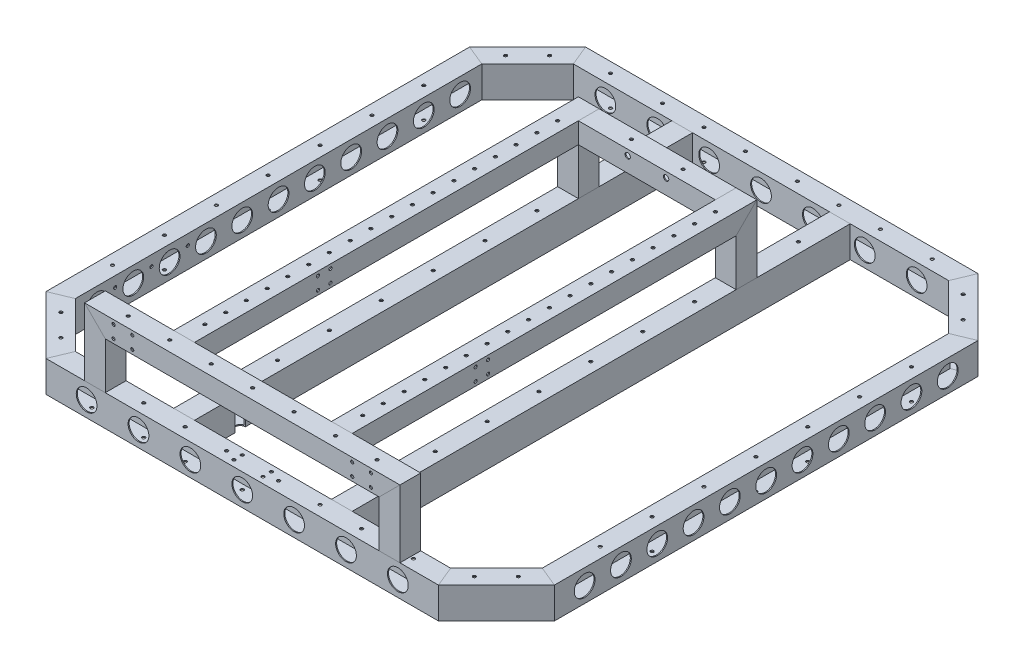
from build123d import *

# Parameters (mm, degrees)
WL_30X20X1_1_DEPTH          = 408.467341191
WL_30X20X1_1_DEPTH_BACK     = 8.467341191
SKETCH_11_W                 = 20
SKETCH_11_H                 = 30
SKETCH_11_W_2               = 18
SKETCH_11_H_2               = 28
SKETCH_11_ON_SEGMENT_2_W    = 20
SKETCH_11_ON_SEGMENT_2_H    = 30
SKETCH_11_ON_SEGMENT_2_W_2  = 18
SKETCH_11_ON_SEGMENT_2_H_2  = 28
WL_30X20X1_1_2_DEPTH        = 87.6453605
SKETCH_11_ON_SEGMENT_3_W    = 20
SKETCH_11_ON_SEGMENT_3_H    = 30
SKETCH_11_ON_SEGMENT_3_W_2  = 18
SKETCH_11_ON_SEGMENT_3_H_2  = 28
WL_30X20X1_1_3_DEPTH        = 386.934682381
SKETCH_11_ON_SEGMENT_4_W    = 20
SKETCH_11_ON_SEGMENT_4_H    = 30
SKETCH_11_ON_SEGMENT_4_W_2  = 18
SKETCH_11_ON_SEGMENT_4_H_2  = 28
WL_30X20X1_1_4_DEPTH        = 87.6453605
SKETCH_11_ON_SEGMENT_5_W    = 20
SKETCH_11_ON_SEGMENT_5_H    = 30
SKETCH_11_ON_SEGMENT_5_W_2  = 18
SKETCH_11_ON_SEGMENT_5_H_2  = 28
WL_30X20X1_1_5_DEPTH        = 416.934682381
SKETCH_11_ON_SEGMENT_6_W    = 20
SKETCH_11_ON_SEGMENT_6_H    = 30
SKETCH_11_ON_SEGMENT_6_W_2  = 18
SKETCH_11_ON_SEGMENT_6_H_2  = 28
WL_30X20X1_1_6_DEPTH        = 87.6453605
SKETCH_11_ON_SEGMENT_7_W    = 20
SKETCH_11_ON_SEGMENT_7_H    = 30
SKETCH_11_ON_SEGMENT_7_W_2  = 18
SKETCH_11_ON_SEGMENT_7_H_2  = 28
WL_30X20X1_1_7_DEPTH        = 386.934682381
SKETCH_11_ON_SEGMENT_8_W    = 20
SKETCH_11_ON_SEGMENT_8_H    = 30
SKETCH_11_ON_SEGMENT_8_W_2  = 18
SKETCH_11_ON_SEGMENT_8_H_2  = 28
WL_30X20X1_1_8_DEPTH        = 87.6453605
SKETCH_11_ON_SEGMENT_9_W    = 20
SKETCH_11_ON_SEGMENT_9_H    = 30
SKETCH_11_ON_SEGMENT_9_W_2  = 18
SKETCH_11_ON_SEGMENT_9_H_2  = 28
WL_30X20X1_1_9_DEPTH        = 502
SKETCH_11_ON_SEGMENT_10_W   = 20
SKETCH_11_ON_SEGMENT_10_H   = 30
SKETCH_11_ON_SEGMENT_10_W_2 = 18
SKETCH_11_ON_SEGMENT_10_H_2 = 28
WL_30X20X1_1_10_DEPTH       = 502
SKETCH_16_W                 = 20
SKETCH_16_H                 = 20
SKETCH_16_W_2               = 18
SKETCH_16_H_2               = 18
WL_20X20X1_1_DEPTH          = 70.142135624
SKETCH_16_ON_SEGMENT_2_W    = 20
SKETCH_16_ON_SEGMENT_2_H    = 20
SKETCH_16_ON_SEGMENT_2_W_2  = 18
SKETCH_16_ON_SEGMENT_2_H_2  = 18
WL_20X20X1_1_2_DEPTH        = 314.284271247
SKETCH_16_ON_SEGMENT_3_W    = 20
SKETCH_16_ON_SEGMENT_3_H    = 20
SKETCH_16_ON_SEGMENT_3_W_2  = 18
SKETCH_16_ON_SEGMENT_3_H_2  = 18
WL_20X20X1_1_3_DEPTH        = 70.142135624
SKETCH_17_ON_SEGMENT_1_W    = 20
SKETCH_17_ON_SEGMENT_1_H    = 20
SKETCH_17_ON_SEGMENT_1_W_2  = 18
SKETCH_17_ON_SEGMENT_1_H_2  = 18
WL_20X20X1_2_DEPTH          = 70.142135624
WL_20X20X1_2_2_DEPTH        = 380
WL_20X20X1_2_2_DEPTH_BACK   = 15.142135624
SKETCH_17_W                 = 20
SKETCH_17_H                 = 20
SKETCH_17_W_2               = 18
SKETCH_17_H_2               = 18
SKETCH_17_ON_SEGMENT_3_W    = 20
SKETCH_17_ON_SEGMENT_3_H    = 20
SKETCH_17_ON_SEGMENT_3_W_2  = 18
SKETCH_17_ON_SEGMENT_3_H_2  = 18
WL_20X20X1_2_3_DEPTH        = 70.142135624
SKETCH_17_ON_SEGMENT_4_W    = 20
SKETCH_17_ON_SEGMENT_4_H    = 20
SKETCH_17_ON_SEGMENT_4_W_2  = 18
SKETCH_17_ON_SEGMENT_4_H_2  = 18
WL_20X20X1_2_4_DEPTH        = 395.142135624
SKETCH_19_W                 = 20
SKETCH_19_H                 = 20
SKETCH_19_W_2               = 18
SKETCH_19_H_2               = 18
WL_20X20X1_3_DEPTH          = 132
SKETCH_20_R                 = 5
CUT_EXTRUDE_1_DEPTH         = 30
SKETCH_21_R                 = 1.5
CUT_EXTRUDE_2_DEPTH         = 30
SKETCH_22_R                 = 1.5
CUT_EXTRUDE_3_DEPTH         = 30
SKETCH_23_R                 = 1.5
CUT_EXTRUDE_4_DEPTH         = 20
SKETCH_24_R                 = 1.5
CUT_EXTRUDE_5_DEPTH         = 30
SKETCH_25_R                 = 1.5
CUT_EXTRUDE_6_DEPTH         = 20
SKETCH_26_R                 = 1.5
CUT_EXTRUDE_7_DEPTH         = 20
SKETCH_27_R                 = 2.6
CUT_EXTRUDE_8_DEPTH         = 20
SKETCH_28_R                 = 1.5
CUT_EXTRUDE_9_DEPTH         = 425.622875107
SKETCH_30_R                 = 10
CUT_EXTRUDE_10_DEPTH        = 20
CUT_EXTRUDE_START           = -20
SKETCH_31_R                 = 10
CUT_EXTRUDE_11_DEPTH        = 20
SKETCH_32_R                 = 10
CUT_EXTRUDE_13_DEPTH        = 20
SKETCH_33_R                 = 10
CUT_EXTRUDE_14_DEPTH        = 20
SKETCH_34_R                 = 1.5
CUT_EXTRUDE_15_DEPTH        = 20


with BuildPart() as part:
    # 草图11 → Wl 30X20X1(1) (new, two sides: drawn at the far end of the back side and taken through both)
    with BuildSketch(Plane(origin=(-235, 0, 200), x_dir=(-1, 0, 0), z_dir=(0, 0, -1)).offset(-WL_30X20X1_1_DEPTH_BACK)):
        Rectangle(SKETCH_11_W, SKETCH_11_H)
        Rectangle(SKETCH_11_W_2, SKETCH_11_H_2, mode=Mode.SUBTRACT)
    extrude(amount=WL_30X20X1_1_DEPTH + WL_30X20X1_1_DEPTH_BACK)

    # Wl 30X20X1(1) mitre 1
    split(bisect_by=Plane(origin=(-235, 0, 200), x_dir=(0, 1, 0), z_dir=(-0.382683432, 0, -0.923879533)), keep=Keep.TOP)

    # Wl 30X20X1(1) mitre 2
    split(bisect_by=Plane(origin=(-235, 0, -200), x_dir=(0, -1, 0), z_dir=(-0.382683432, 0, 0.923879533)), keep=Keep.TOP)


with BuildPart() as body_2:
    # 草图11 on segment 2 (carried to segment 2) → Wl 30X20X1_1 2 (new body)
    with BuildSketch(Plane(origin=(-240.987314375, 0, -194.012685625), x_dir=(-0.707106781, 0, -0.707106781), z_dir=(0.707106781, 0, -0.707106781))):
        Rectangle(SKETCH_11_ON_SEGMENT_2_W, SKETCH_11_ON_SEGMENT_2_H)
        Rectangle(SKETCH_11_ON_SEGMENT_2_W_2, SKETCH_11_ON_SEGMENT_2_H_2, mode=Mode.SUBTRACT)
    extrude(amount=WL_30X20X1_1_2_DEPTH)

    # Wl 30X20X1_1 2 mitre 1
    split(bisect_by=Plane(origin=(-185, 0, -250), x_dir=(0, -1, 0), z_dir=(-0.923879533, 0, 0.382683432)), keep=Keep.TOP)

    # Wl 30X20X1_1 2 mitre 2
    split(bisect_by=Plane(origin=(-235, 0, -200), x_dir=(0, 1, 0), z_dir=(0.382683432, 0, -0.923879533)), keep=Keep.TOP)


with BuildPart() as body_3:
    # 草图11 on segment 3 (carried to segment 3) → Wl 30X20X1_1 3 (new body)
    with BuildSketch(Plane(origin=(-193.467341191, 0, -250), x_dir=(0, 0, -1), z_dir=(1, 0, 0))):
        Rectangle(SKETCH_11_ON_SEGMENT_3_W, SKETCH_11_ON_SEGMENT_3_H)
        Rectangle(SKETCH_11_ON_SEGMENT_3_W_2, SKETCH_11_ON_SEGMENT_3_H_2, mode=Mode.SUBTRACT)
    extrude(amount=WL_30X20X1_1_3_DEPTH)

    # Wl 30X20X1_1 3 mitre 1
    split(bisect_by=Plane(origin=(-185, 0, -250), x_dir=(0, 1, 0), z_dir=(0.923879533, 0, -0.382683432)), keep=Keep.TOP)

    # Wl 30X20X1_1 3 mitre 2
    split(bisect_by=Plane(origin=(185, 0, -250), x_dir=(0, -1, 0), z_dir=(-0.923879533, 0, -0.382683432)), keep=Keep.TOP)


with BuildPart() as body_4:
    # 草图11 on segment 4 (carried to segment 4) → Wl 30X20X1_1 4 (new body)
    with BuildSketch(Plane(origin=(179.012685625, 0, -255.987314375), x_dir=(0.707106781, 0, -0.707106781), z_dir=(0.707106781, 0, 0.707106781))):
        Rectangle(SKETCH_11_ON_SEGMENT_4_W, SKETCH_11_ON_SEGMENT_4_H)
        Rectangle(SKETCH_11_ON_SEGMENT_4_W_2, SKETCH_11_ON_SEGMENT_4_H_2, mode=Mode.SUBTRACT)
    extrude(amount=WL_30X20X1_1_4_DEPTH)

    # Wl 30X20X1_1 4 mitre 1
    split(bisect_by=Plane(origin=(185, 0, -250), x_dir=(0, 1, 0), z_dir=(0.923879533, 0, 0.382683432)), keep=Keep.TOP)

    # Wl 30X20X1_1 4 mitre 2
    split(bisect_by=Plane(origin=(235, 0, -200), x_dir=(0, 1, 0), z_dir=(-0.382683432, 0, -0.923879533)), keep=Keep.TOP)


with BuildPart() as body_5:
    # 草图11 on segment 5 (carried to segment 5) → Wl 30X20X1_1 5 (new body)
    with BuildSketch(Plane(origin=(235, 0, -208.467341191), x_dir=(1, 0, 0), z_dir=(0, 0, 1))):
        Rectangle(SKETCH_11_ON_SEGMENT_5_W, SKETCH_11_ON_SEGMENT_5_H)
        Rectangle(SKETCH_11_ON_SEGMENT_5_W_2, SKETCH_11_ON_SEGMENT_5_H_2, mode=Mode.SUBTRACT)
    extrude(amount=WL_30X20X1_1_5_DEPTH)

    # Wl 30X20X1_1 5 mitre 1
    split(bisect_by=Plane(origin=(235, 0, 200), x_dir=(0, 1, 0), z_dir=(0.382683432, 0, -0.923879533)), keep=Keep.TOP)

    # Wl 30X20X1_1 5 mitre 2
    split(bisect_by=Plane(origin=(235, 0, -200), x_dir=(0, -1, 0), z_dir=(0.382683432, 0, 0.923879533)), keep=Keep.TOP)


with BuildPart() as body_6:
    # 草图11 on segment 6 (carried to segment 6) → Wl 30X20X1_1 6 (new body)
    with BuildSketch(Plane(origin=(240.987314375, 0, 194.012685625), x_dir=(0.707106781, 0, 0.707106781), z_dir=(-0.707106781, 0, 0.707106781))):
        Rectangle(SKETCH_11_ON_SEGMENT_6_W, SKETCH_11_ON_SEGMENT_6_H)
        Rectangle(SKETCH_11_ON_SEGMENT_6_W_2, SKETCH_11_ON_SEGMENT_6_H_2, mode=Mode.SUBTRACT)
    extrude(amount=WL_30X20X1_1_6_DEPTH)

    # Wl 30X20X1_1 6 mitre 1
    split(bisect_by=Plane(origin=(185, 0, 250), x_dir=(0, 1, 0), z_dir=(0.923879533, 0, -0.382683432)), keep=Keep.TOP)

    # Wl 30X20X1_1 6 mitre 2
    split(bisect_by=Plane(origin=(235, 0, 200), x_dir=(0, -1, 0), z_dir=(-0.382683432, 0, 0.923879533)), keep=Keep.TOP)


with BuildPart() as body_7:
    # 草图11 on segment 7 (carried to segment 7) → Wl 30X20X1_1 7 (new body)
    with BuildSketch(Plane(origin=(193.467341191, 0, 250), x_dir=(0, 0, 1), z_dir=(-1, 0, 0))):
        Rectangle(SKETCH_11_ON_SEGMENT_7_W, SKETCH_11_ON_SEGMENT_7_H)
        Rectangle(SKETCH_11_ON_SEGMENT_7_W_2, SKETCH_11_ON_SEGMENT_7_H_2, mode=Mode.SUBTRACT)
    extrude(amount=WL_30X20X1_1_7_DEPTH)

    # Wl 30X20X1_1 7 mitre 1
    split(bisect_by=Plane(origin=(-185, 0, 250), x_dir=(0, 1, 0), z_dir=(0.923879533, 0, 0.382683432)), keep=Keep.TOP)

    # Wl 30X20X1_1 7 mitre 2
    split(bisect_by=Plane(origin=(185, 0, 250), x_dir=(0, -1, 0), z_dir=(-0.923879533, 0, 0.382683432)), keep=Keep.TOP)


with BuildPart() as body_8:
    # 草图11 on segment 8 (carried to segment 8) → Wl 30X20X1_1 8 (new body)
    with BuildSketch(Plane(origin=(-179.012685625, 0, 255.987314375), x_dir=(-0.707106781, 0, 0.707106781), z_dir=(-0.707106781, 0, -0.707106781))):
        Rectangle(SKETCH_11_ON_SEGMENT_8_W, SKETCH_11_ON_SEGMENT_8_H)
        Rectangle(SKETCH_11_ON_SEGMENT_8_W_2, SKETCH_11_ON_SEGMENT_8_H_2, mode=Mode.SUBTRACT)
    extrude(amount=WL_30X20X1_1_8_DEPTH)

    # Wl 30X20X1_1 8 mitre 1
    split(bisect_by=Plane(origin=(-185, 0, 250), x_dir=(0, -1, 0), z_dir=(-0.923879533, 0, -0.382683432)), keep=Keep.TOP)

    # Wl 30X20X1_1 8 mitre 2
    split(bisect_by=Plane(origin=(-235, 0, 200), x_dir=(0, -1, 0), z_dir=(0.382683432, 0, 0.923879533)), keep=Keep.TOP)


with BuildPart() as body_9:
    # 草图11 on segment 9 (carried to segment 9) → Wl 30X20X1_1 9 (new body)
    with BuildSketch(Plane(origin=(-76, 0, -251), x_dir=(1, 0, 0), z_dir=(0, 0, 1))):
        Rectangle(SKETCH_11_ON_SEGMENT_9_W, SKETCH_11_ON_SEGMENT_9_H)
        Rectangle(SKETCH_11_ON_SEGMENT_9_W_2, SKETCH_11_ON_SEGMENT_9_H_2, mode=Mode.SUBTRACT)
    extrude(amount=WL_30X20X1_1_9_DEPTH)

    # Wl 30X20X1_1 9 mitre 1
    split(bisect_by=Plane(origin=(-76, 0, -240), x_dir=(0, -1, 0), z_dir=(0, 0, 1)), keep=Keep.TOP)

    # Wl 30X20X1_1 9 mitre 2
    split(bisect_by=Plane(origin=(-76, 0, 240), x_dir=(0, 1, 0), z_dir=(0, 0, -1)), keep=Keep.TOP)


with BuildPart() as body_10:
    # 草图11 on segment 10 (carried to segment 10) → Wl 30X20X1_1 10 (new body)
    with BuildSketch(Plane(origin=(76, 0, -251), x_dir=(1, 0, 0), z_dir=(0, 0, 1))):
        Rectangle(SKETCH_11_ON_SEGMENT_10_W, SKETCH_11_ON_SEGMENT_10_H)
        Rectangle(SKETCH_11_ON_SEGMENT_10_W_2, SKETCH_11_ON_SEGMENT_10_H_2, mode=Mode.SUBTRACT)
    extrude(amount=WL_30X20X1_1_10_DEPTH)

    # Wl 30X20X1_1 10 mitre 1
    split(bisect_by=Plane(origin=(76, 0, -240), x_dir=(0, -1, 0), z_dir=(0, 0, 1)), keep=Keep.TOP)

    # Wl 30X20X1_1 10 mitre 2
    split(bisect_by=Plane(origin=(76, 0, 240), x_dir=(0, 1, 0), z_dir=(0, 0, -1)), keep=Keep.TOP)


with BuildPart() as body_11:
    # 草图16 → Wl 20X20X1(1) (new body)
    with BuildSketch(Plane(origin=(-142, 15, 250), x_dir=(-1, 0, 0), z_dir=(0, 1, 0))):
        Rectangle(SKETCH_16_W, SKETCH_16_H)
        Rectangle(SKETCH_16_W_2, SKETCH_16_H_2, mode=Mode.SUBTRACT)
    extrude(amount=WL_20X20X1_1_DEPTH)

    # Wl 20X20X1(1) mitre 1
    split(bisect_by=Plane(origin=(-142, 70, 250), x_dir=(0.707106781, -0.707106781, 0), z_dir=(-0.707106781, -0.707106781, 0)), keep=Keep.TOP)


with BuildPart() as body_12:
    # 草图16 on segment 2 (carried to segment 2) → Wl 20X20X1_1 2 (new body)
    with BuildSketch(Plane(origin=(-157.142135624, 70, 250), x_dir=(0, 1, 0), z_dir=(1, 0, 0))):
        Rectangle(SKETCH_16_ON_SEGMENT_2_W, SKETCH_16_ON_SEGMENT_2_H)
        Rectangle(SKETCH_16_ON_SEGMENT_2_W_2, SKETCH_16_ON_SEGMENT_2_H_2, mode=Mode.SUBTRACT)
    extrude(amount=WL_20X20X1_1_2_DEPTH)

    # Wl 20X20X1_1 2 mitre 1
    split(bisect_by=Plane(origin=(-142, 70, 250), x_dir=(-0.707106781, 0.707106781, 0), z_dir=(0.707106781, 0.707106781, 0)), keep=Keep.TOP)

    # Wl 20X20X1_1 2 mitre 2
    split(bisect_by=Plane(origin=(142, 70, 250), x_dir=(-0.707106781, -0.707106781, 0), z_dir=(-0.707106781, 0.707106781, 0)), keep=Keep.TOP)

    # 草图25 → 切除-拉伸6 (cut)
    with BuildSketch(Plane(origin=(69.85871265, 41.067691758, 260), x_dir=(1, 0, 0), z_dir=(0, 0, 1))):
        with Locations((-175.85871265, 22.932308242)):
            Circle(SKETCH_25_R)
        with Locations((-175.85871265, 34.932308242)):
            Circle(SKETCH_25_R)
        with Locations((-193.85871265, 22.932308242)):
            Circle(SKETCH_25_R)
        with Locations((-193.85871265, 34.932308242)):
            Circle(SKETCH_25_R)
        with Locations((54.14128735, 34.932308241)):
            Circle(SKETCH_25_R)
        with Locations((54.14128735, 22.932308241)):
            Circle(SKETCH_25_R)
        with Locations((36.14128735, 22.932308242)):
            Circle(SKETCH_25_R)
        with Locations((36.14128735, 34.932308242)):
            Circle(SKETCH_25_R)
    extrude(amount=-CUT_EXTRUDE_6_DEPTH, mode=Mode.SUBTRACT)


with BuildPart() as body_13:
    # 草图16 on segment 3 (carried to segment 3) → Wl 20X20X1_1 3 (new body)
    with BuildSketch(Plane(origin=(142, 85.142135624, 250), x_dir=(1, 0, 0), z_dir=(0, -1, 0))):
        Rectangle(SKETCH_16_ON_SEGMENT_3_W, SKETCH_16_ON_SEGMENT_3_H)
        Rectangle(SKETCH_16_ON_SEGMENT_3_W_2, SKETCH_16_ON_SEGMENT_3_H_2, mode=Mode.SUBTRACT)
    extrude(amount=WL_20X20X1_1_3_DEPTH)

    # Wl 20X20X1_1 3 mitre 1
    split(bisect_by=Plane(origin=(142, 70, 250), x_dir=(0.707106781, 0.707106781, 0), z_dir=(0.707106781, -0.707106781, 0)), keep=Keep.TOP)


with BuildPart() as body_14:
    # 草图17 on segment 1 (carried to segment 1) → Wl 20X20X1(2) (new body)
    with BuildSketch(Plane(origin=(76, 15, -140), x_dir=(0, 0, 1), z_dir=(0, 1, 0))):
        Rectangle(SKETCH_17_ON_SEGMENT_1_W, SKETCH_17_ON_SEGMENT_1_H)
        Rectangle(SKETCH_17_ON_SEGMENT_1_W_2, SKETCH_17_ON_SEGMENT_1_H_2, mode=Mode.SUBTRACT)
    extrude(amount=WL_20X20X1_2_DEPTH)

    # Wl 20X20X1(2) mitre 1
    split(bisect_by=Plane(origin=(76, 70, -140), x_dir=(1, 0, 0), z_dir=(0, -0.707106781, -0.707106781)), keep=Keep.TOP)


with BuildPart() as body_15:
    # 草图17 → Wl 20X20X1_2 2 (new, two sides: drawn at the far end of the back side and taken through both)
    with BuildSketch(Plane(origin=(76, 70, -140), x_dir=(0, -1, 0), z_dir=(0, 0, 1)).offset(-WL_20X20X1_2_2_DEPTH_BACK)):
        Rectangle(SKETCH_17_W, SKETCH_17_H)
        Rectangle(SKETCH_17_W_2, SKETCH_17_H_2, mode=Mode.SUBTRACT)
    extrude(amount=WL_20X20X1_2_2_DEPTH + WL_20X20X1_2_2_DEPTH_BACK)

    # Wl 20X20X1_2 2 mitre 1
    split(bisect_by=Plane(origin=(76, 70, -140), x_dir=(-1, 0, 0), z_dir=(0, 0.707106781, 0.707106781)), keep=Keep.TOP)


with BuildPart() as body_16:
    # 草图17 on segment 3 (carried to segment 3) → Wl 20X20X1_2 3 (new body)
    with BuildSketch(Plane(origin=(-76, 15, -140), x_dir=(0, 0, 1), z_dir=(0, 1, 0))):
        Rectangle(SKETCH_17_ON_SEGMENT_3_W, SKETCH_17_ON_SEGMENT_3_H)
        Rectangle(SKETCH_17_ON_SEGMENT_3_W_2, SKETCH_17_ON_SEGMENT_3_H_2, mode=Mode.SUBTRACT)
    extrude(amount=WL_20X20X1_2_3_DEPTH)

    # Wl 20X20X1_2 3 mitre 1
    split(bisect_by=Plane(origin=(-76, 70, -140), x_dir=(1, 0, 0), z_dir=(0, -0.707106781, -0.707106781)), keep=Keep.TOP)


with BuildPart() as body_17:
    # 草图17 on segment 4 (carried to segment 4) → Wl 20X20X1_2 4 (new body)
    with BuildSketch(Plane(origin=(-76, 70, -155.142135624), x_dir=(0, -1, 0), z_dir=(0, 0, 1))):
        Rectangle(SKETCH_17_ON_SEGMENT_4_W, SKETCH_17_ON_SEGMENT_4_H)
        Rectangle(SKETCH_17_ON_SEGMENT_4_W_2, SKETCH_17_ON_SEGMENT_4_H_2, mode=Mode.SUBTRACT)
    extrude(amount=WL_20X20X1_2_4_DEPTH)

    # Wl 20X20X1_2 4 mitre 1
    split(bisect_by=Plane(origin=(-76, 70, -140), x_dir=(-1, 0, 0), z_dir=(0, 0.707106781, 0.707106781)), keep=Keep.TOP)


with BuildPart() as body_18:
    # 草图19 → Wl 20X20X1(3) (new body)
    with BuildSketch(Plane(origin=(-66, 70, -140), x_dir=(0, 0, -1), z_dir=(1, 0, 0))):
        Rectangle(SKETCH_19_W, SKETCH_19_H)
        Rectangle(SKETCH_19_W_2, SKETCH_19_H_2, mode=Mode.SUBTRACT)
    extrude(amount=WL_20X20X1_3_DEPTH)


with BuildPart() as cut_extrude_1_tool:
    # 草图20 → 切除-拉伸1 (new body)
    with BuildSketch(Plane.XZ.offset(15)):
        with Locations((-66, 196)):
            Circle(SKETCH_20_R)
        with Locations((66, 196)):
            Circle(SKETCH_20_R)
    extrude(amount=-CUT_EXTRUDE_1_DEPTH)


with BuildPart() as body_9_1:
    add(body_9.part)

    # 切除-拉伸1: cut by cut_extrude_1_tool
    add(cut_extrude_1_tool.part, mode=Mode.SUBTRACT)


with BuildPart() as body_10_1:
    add(body_10.part)

    # 切除-拉伸1: cut by cut_extrude_1_tool
    add(cut_extrude_1_tool.part, mode=Mode.SUBTRACT)


with BuildPart() as cut_extrude_2_tool:
    # 草图21 → 切除-拉伸2 (new body)
    with BuildSketch(Plane.XZ.offset(15)):
        with Locations(Location((25, 250, 0), (0, 0, 270))):
            Circle(SKETCH_21_R)
        with Locations(Location((65, 250, 0), (0, 0, 270))):
            Circle(SKETCH_21_R)
        with Locations(Location((105, 250, 0), (0, 0, 270))):
            Circle(SKETCH_21_R)
        with Locations(Location((155, 250, 0), (0, 0, 270))):
            Circle(SKETCH_21_R)
        with Locations(Location((-155, 250, 0), (0, 0, 270))):
            Circle(SKETCH_21_R)
        with Locations(Location((-105, 250, 0), (0, 0, 270))):
            Circle(SKETCH_21_R)
        with Locations(Location((-65, 250, 0), (0, 0, 270))):
            Circle(SKETCH_21_R)
        with Locations(Location((-25, 250, 0), (0, 0, 270))):
            Circle(SKETCH_21_R)
        with Locations(Location((-25, -250, 0), (0, 0, 270))):
            Circle(SKETCH_21_R)
        with Locations(Location((-65, -250, 0), (0, 0, 270))):
            Circle(SKETCH_21_R)
        with Locations(Location((-105, -250, 0), (0, 0, 270))):
            Circle(SKETCH_21_R)
        with Locations(Location((-155, -250, 0), (0, 0, 270))):
            Circle(SKETCH_21_R)
        with Locations(Location((155, -250, 0), (0, 0, 270))):
            Circle(SKETCH_21_R)
        with Locations(Location((105, -250, 0), (0, 0, 270))):
            Circle(SKETCH_21_R)
        with Locations(Location((65, -250, 0), (0, 0, 270))):
            Circle(SKETCH_21_R)
        with Locations(Location((25, -250, 0), (0, 0, 270))):
            Circle(SKETCH_21_R)
        with Locations(Location((-14, 254, 0), (0, 0, 270))):
            Circle(SKETCH_21_R)
        with Locations(Location((-14, 246, 0), (0, 0, 270))):
            Circle(SKETCH_21_R)
        with Locations(Location((14, 246, 0), (0, 0, 270))):
            Circle(SKETCH_21_R)
        with Locations(Location((14, 254, 0), (0, 0, 270))):
            Circle(SKETCH_21_R)
    extrude(amount=-CUT_EXTRUDE_2_DEPTH)


with BuildPart() as body_3_1:
    add(body_3.part)

    # 切除-拉伸2: cut by cut_extrude_2_tool
    add(cut_extrude_2_tool.part, mode=Mode.SUBTRACT)

    # 草图32 → 切除-拉伸13 (cut)
    with BuildSketch(Plane(origin=(0, 0, -260), x_dir=(-1, 0, 0), z_dir=(0, 0, -1))):
        Circle(SKETCH_32_R)
        with Locations((50, 0)):
            Circle(SKETCH_32_R)
        with Locations((100, 0)):
            Circle(SKETCH_32_R)
        with Locations((150, 0)):
            Circle(SKETCH_32_R)
        with Locations(Location((-150, 0, 0), (0, 0, 180))):
            Circle(SKETCH_32_R)
        with Locations(Location((-100, 0, 0), (0, 0, 180))):
            Circle(SKETCH_32_R)
        with Locations(Location((-50, 0, 0), (0, 0, 180))):
            Circle(SKETCH_32_R)
    extrude(amount=-CUT_EXTRUDE_13_DEPTH, mode=Mode.SUBTRACT)


with BuildPart() as body_7_1:
    add(body_7.part)

    # 切除-拉伸2: cut by cut_extrude_2_tool
    add(cut_extrude_2_tool.part, mode=Mode.SUBTRACT)

    # 草图33 → 切除-拉伸14 (cut)
    with BuildSketch(Plane.XY.offset(260)):
        with Locations(Location((0, 0, 0), (0, 0, 180))):
            Circle(SKETCH_33_R)
        with Locations((50, 0)):
            Circle(SKETCH_33_R)
        with Locations((100, 0)):
            Circle(SKETCH_33_R)
        with Locations((150, 0)):
            Circle(SKETCH_33_R)
        with Locations(Location((-150, 0, 0), (0, 0, 180))):
            Circle(SKETCH_33_R)
        with Locations(Location((-100, 0, 0), (0, 0, 180))):
            Circle(SKETCH_33_R)
        with Locations(Location((-50, 0, 0), (0, 0, 180))):
            Circle(SKETCH_33_R)
    extrude(amount=-CUT_EXTRUDE_14_DEPTH, mode=Mode.SUBTRACT)


with BuildPart() as cut_extrude_3_tool:
    # 草图22 → 切除-拉伸3 (new body)
    with BuildSketch(Plane.XZ.offset(15)):
        with Locations(Location((-235, 0, 0), (0, 0, 270))):
            Circle(SKETCH_22_R)
        with Locations(Location((-235, 50, 0), (0, 0, 270))):
            Circle(SKETCH_22_R)
        with Locations(Location((-235, 100, 0), (0, 0, 270))):
            Circle(SKETCH_22_R)
        with Locations(Location((-235, 150, 0), (0, 0, 270))):
            Circle(SKETCH_22_R)
        with Locations(Location((-235, -150, 0), (0, 0, 270))):
            Circle(SKETCH_22_R)
        with Locations(Location((-235, -100, 0), (0, 0, 270))):
            Circle(SKETCH_22_R)
        with Locations(Location((-235, -50, 0), (0, 0, 270))):
            Circle(SKETCH_22_R)
        with Locations(Location((-76, 0, 0), (0, 0, 270))):
            Circle(SKETCH_22_R)
        with Locations(Location((-76, 50, 0), (0, 0, 270))):
            Circle(SKETCH_22_R)
        with Locations(Location((-76, 100, 0), (0, 0, 270))):
            Circle(SKETCH_22_R)
        with Locations(Location((-76, 150, 0), (0, 0, 270))):
            Circle(SKETCH_22_R)
        with Locations(Location((-76, 200, 0), (0, 0, 270))):
            Circle(SKETCH_22_R)
        with Locations(Location((-76, -200, 0), (0, 0, 270))):
            Circle(SKETCH_22_R)
        with Locations(Location((-76, -150, 0), (0, 0, 270))):
            Circle(SKETCH_22_R)
        with Locations(Location((-76, -100, 0), (0, 0, 270))):
            Circle(SKETCH_22_R)
        with Locations(Location((-76, -50, 0), (0, 0, 270))):
            Circle(SKETCH_22_R)
        with Locations(Location((76, -50, 0), (0, 0, 270))):
            Circle(SKETCH_22_R)
        with Locations(Location((76, -100, 0), (0, 0, 270))):
            Circle(SKETCH_22_R)
        with Locations(Location((76, -150, 0), (0, 0, 270))):
            Circle(SKETCH_22_R)
        with Locations(Location((76, -200, 0), (0, 0, 270))):
            Circle(SKETCH_22_R)
        with Locations(Location((76, 200, 0), (0, 0, 270))):
            Circle(SKETCH_22_R)
        with Locations(Location((76, 150, 0), (0, 0, 270))):
            Circle(SKETCH_22_R)
        with Locations(Location((76, 100, 0), (0, 0, 270))):
            Circle(SKETCH_22_R)
        with Locations(Location((76, 50, 0), (0, 0, 270))):
            Circle(SKETCH_22_R)
        with Locations(Location((76, 0, 0), (0, 0, 270))):
            Circle(SKETCH_22_R)
        with Locations(Location((235, -50, 0), (0, 0, 270))):
            Circle(SKETCH_22_R)
        with Locations(Location((235, -100, 0), (0, 0, 270))):
            Circle(SKETCH_22_R)
        with Locations(Location((235, -150, 0), (0, 0, 270))):
            Circle(SKETCH_22_R)
        with Locations(Location((235, 150, 0), (0, 0, 270))):
            Circle(SKETCH_22_R)
        with Locations(Location((235, 100, 0), (0, 0, 270))):
            Circle(SKETCH_22_R)
        with Locations(Location((235, 50, 0), (0, 0, 270))):
            Circle(SKETCH_22_R)
        with Locations(Location((235, 0, 0), (0, 0, 270))):
            Circle(SKETCH_22_R)
    extrude(amount=-CUT_EXTRUDE_3_DEPTH)


with BuildPart() as part_1:
    add(part.part)

    # 切除-拉伸3: cut by cut_extrude_3_tool
    add(cut_extrude_3_tool.part, mode=Mode.SUBTRACT)

    # 草图30 → 切除-拉伸10 (cut)
    with BuildSketch(Plane.ZY.offset(245)):
        Circle(SKETCH_30_R)
        with Locations((35, 0)):
            Circle(SKETCH_30_R)
        with Locations((70, 0)):
            Circle(SKETCH_30_R)
        with Locations((105, 0)):
            Circle(SKETCH_30_R)
        with Locations((140, 0)):
            Circle(SKETCH_30_R)
        with Locations((175, 0)):
            Circle(SKETCH_30_R)
        with Locations(Location((-175, 0, 0), (0, 0, 180))):
            Circle(SKETCH_30_R)
        with Locations(Location((-140, 0, 0), (0, 0, 180))):
            Circle(SKETCH_30_R)
        with Locations(Location((-105, 0, 0), (0, 0, 180))):
            Circle(SKETCH_30_R)
        with Locations(Location((-70, 0, 0), (0, 0, 180))):
            Circle(SKETCH_30_R)
        with Locations(Location((-35, 0, 0), (0, 0, 180))):
            Circle(SKETCH_30_R)
    extrude(amount=-CUT_EXTRUDE_10_DEPTH, mode=Mode.SUBTRACT)

    # 草图34 → 切除-拉伸15 (cut)
    with BuildSketch(Plane.ZY.offset(245)):
        with Locations((157.5, 5)):
            Circle(SKETCH_34_R)
        with Locations((122.5, 5)):
            Circle(SKETCH_34_R)
        with Locations((87.5, 5)):
            Circle(SKETCH_34_R)
    extrude(amount=-CUT_EXTRUDE_15_DEPTH, mode=Mode.SUBTRACT)


with BuildPart() as body_5_1:
    add(body_5.part)

    # 切除-拉伸3: cut by cut_extrude_3_tool
    add(cut_extrude_3_tool.part, mode=Mode.SUBTRACT)

    # 草图31 → 切除-拉伸11 (cut)
    with BuildSketch(Plane(origin=(245, 0, 0), x_dir=(0, 0, -1), z_dir=(1, 0, 0)).offset(CUT_EXTRUDE_START)):
        with Locations(Location((0, 0, 0), (0, 0, 180))):
            Circle(SKETCH_31_R)
        with Locations((35, 0)):
            Circle(SKETCH_31_R)
        with Locations((70, 0)):
            Circle(SKETCH_31_R)
        with Locations((105, 0)):
            Circle(SKETCH_31_R)
        with Locations((140, 0)):
            Circle(SKETCH_31_R)
        with Locations((175, 0)):
            Circle(SKETCH_31_R)
        with Locations(Location((-175, 0, 0), (0, 0, 180))):
            Circle(SKETCH_31_R)
        with Locations(Location((-140, 0, 0), (0, 0, 180))):
            Circle(SKETCH_31_R)
        with Locations(Location((-105, 0, 0), (0, 0, 180))):
            Circle(SKETCH_31_R)
        with Locations(Location((-70, 0, 0), (0, 0, 180))):
            Circle(SKETCH_31_R)
        with Locations(Location((-35, 0, 0), (0, 0, 180))):
            Circle(SKETCH_31_R)
    extrude(amount=CUT_EXTRUDE_11_DEPTH, mode=Mode.SUBTRACT)


with BuildPart() as body_9_2:
    add(body_9_1.part)

    # 切除-拉伸3: cut by cut_extrude_3_tool
    add(cut_extrude_3_tool.part, mode=Mode.SUBTRACT)


with BuildPart() as body_10_2:
    add(body_10_1.part)

    # 切除-拉伸3: cut by cut_extrude_3_tool
    add(cut_extrude_3_tool.part, mode=Mode.SUBTRACT)


with BuildPart() as cut_extrude_4_tool:
    # 草图23 → 切除-拉伸4 (new body)
    with BuildSketch(Plane(origin=(0, 80, 0), x_dir=(1, 0, 0), z_dir=(0, 1, 0))):
        with Locations(Location((-76, 120, 0), (0, 0, 270))):
            Circle(SKETCH_23_R)
        with Locations(Location((-76, 100, 0), (0, 0, 270))):
            Circle(SKETCH_23_R)
        with Locations(Location((-76, 80, 0), (0, 0, 270))):
            Circle(SKETCH_23_R)
        with Locations(Location((-76, 60, 0), (0, 0, 270))):
            Circle(SKETCH_23_R)
        with Locations(Location((-76, 40, 0), (0, 0, 270))):
            Circle(SKETCH_23_R)
        with Locations(Location((-76, 20, 0), (0, 0, 270))):
            Circle(SKETCH_23_R)
        with Locations(Location((-76, 0, 0), (0, 0, 270))):
            Circle(SKETCH_23_R)
        with Locations(Location((-76, -20, 0), (0, 0, 270))):
            Circle(SKETCH_23_R)
        with Locations(Location((-76, -40, 0), (0, 0, 270))):
            Circle(SKETCH_23_R)
        with Locations(Location((-76, -60, 0), (0, 0, 270))):
            Circle(SKETCH_23_R)
        with Locations(Location((-76, -80, 0), (0, 0, 270))):
            Circle(SKETCH_23_R)
        with Locations(Location((-76, -100, 0), (0, 0, 270))):
            Circle(SKETCH_23_R)
        with Locations(Location((-76, -120, 0), (0, 0, 270))):
            Circle(SKETCH_23_R)
        with Locations(Location((-76, -140, 0), (0, 0, 270))):
            Circle(SKETCH_23_R)
        with Locations(Location((-76, -160, 0), (0, 0, 270))):
            Circle(SKETCH_23_R)
        with Locations(Location((-76, -180, 0), (0, 0, 270))):
            Circle(SKETCH_23_R)
        with Locations(Location((-76, -200, 0), (0, 0, 270))):
            Circle(SKETCH_23_R)
        with Locations(Location((-76, -220, 0), (0, 0, 270))):
            Circle(SKETCH_23_R)
        with Locations(Location((76, -220, 0), (0, 0, 90))):
            Circle(SKETCH_23_R)
        with Locations(Location((76, -200, 0), (0, 0, 90))):
            Circle(SKETCH_23_R)
        with Locations(Location((76, -180, 0), (0, 0, 90))):
            Circle(SKETCH_23_R)
        with Locations(Location((76, -160, 0), (0, 0, 90))):
            Circle(SKETCH_23_R)
        with Locations(Location((76, -140, 0), (0, 0, 90))):
            Circle(SKETCH_23_R)
        with Locations(Location((76, -120, 0), (0, 0, 90))):
            Circle(SKETCH_23_R)
        with Locations(Location((76, -100, 0), (0, 0, 90))):
            Circle(SKETCH_23_R)
        with Locations(Location((76, -80, 0), (0, 0, 90))):
            Circle(SKETCH_23_R)
        with Locations(Location((76, -60, 0), (0, 0, 90))):
            Circle(SKETCH_23_R)
        with Locations(Location((76, -40, 0), (0, 0, 90))):
            Circle(SKETCH_23_R)
        with Locations(Location((76, -20, 0), (0, 0, 90))):
            Circle(SKETCH_23_R)
        with Locations(Location((76, 0, 0), (0, 0, 90))):
            Circle(SKETCH_23_R)
        with Locations(Location((76, 20, 0), (0, 0, 90))):
            Circle(SKETCH_23_R)
        with Locations(Location((76, 40, 0), (0, 0, 90))):
            Circle(SKETCH_23_R)
        with Locations(Location((76, 60, 0), (0, 0, 90))):
            Circle(SKETCH_23_R)
        with Locations(Location((76, 80, 0), (0, 0, 90))):
            Circle(SKETCH_23_R)
        with Locations(Location((76, 100, 0), (0, 0, 90))):
            Circle(SKETCH_23_R)
        with Locations(Location((76, 120, 0), (0, 0, 90))):
            Circle(SKETCH_23_R)
    extrude(amount=-CUT_EXTRUDE_4_DEPTH)


with BuildPart() as body_15_1:
    add(body_15.part)

    # 切除-拉伸4: cut by cut_extrude_4_tool
    add(cut_extrude_4_tool.part, mode=Mode.SUBTRACT)


with BuildPart() as body_17_1:
    add(body_17.part)

    # 切除-拉伸4: cut by cut_extrude_4_tool
    add(cut_extrude_4_tool.part, mode=Mode.SUBTRACT)


with BuildPart() as cut_extrude_5_tool:
    # 草图24 → 切除-拉伸5 (new body)
    with BuildSketch(Plane(origin=(69.85871265, -15, 0), x_dir=(1, 0, 0), z_dir=(0, -1, 0))):
        with Locations(Location((-290.394246556, -214.32233047, 0), (0, 0, 270))):
            Circle(SKETCH_24_R)
        with Locations(Location((-269.181043121, -235.535533906, 0), (0, 0, 270))):
            Circle(SKETCH_24_R)
        with Locations(Location((129.46361782, -235.535533906, 0), (0, 0, 270))):
            Circle(SKETCH_24_R)
        with Locations(Location((150.676821255, -214.32233047, 0), (0, 0, 270))):
            Circle(SKETCH_24_R)
        with Locations(Location((150.676821255, 214.32233047, 0), (0, 0, 270))):
            Circle(SKETCH_24_R)
        with Locations(Location((129.46361782, 235.535533906, 0), (0, 0, 270))):
            Circle(SKETCH_24_R)
        with Locations(Location((-290.394246556, 214.32233047, 0), (0, 0, 270))):
            Circle(SKETCH_24_R)
        with Locations(Location((-269.181043121, 235.535533906, 0), (0, 0, 270))):
            Circle(SKETCH_24_R)
    extrude(amount=-CUT_EXTRUDE_5_DEPTH)


with BuildPart() as body_2_1:
    add(body_2.part)

    # 切除-拉伸5: cut by cut_extrude_5_tool
    add(cut_extrude_5_tool.part, mode=Mode.SUBTRACT)


with BuildPart() as body_4_1:
    add(body_4.part)

    # 切除-拉伸5: cut by cut_extrude_5_tool
    add(cut_extrude_5_tool.part, mode=Mode.SUBTRACT)


with BuildPart() as body_6_1:
    add(body_6.part)

    # 切除-拉伸5: cut by cut_extrude_5_tool
    add(cut_extrude_5_tool.part, mode=Mode.SUBTRACT)


with BuildPart() as body_8_1:
    add(body_8.part)

    # 切除-拉伸5: cut by cut_extrude_5_tool
    add(cut_extrude_5_tool.part, mode=Mode.SUBTRACT)


with BuildPart() as cut_extrude_7_tool:
    # 草图26 → 切除-拉伸7 (new body)
    with BuildSketch(Plane(origin=(0, 80, 0), x_dir=(1, 0, 0), z_dir=(0, 1, 0))):
        with Locations(Location((0, -250, 0), (0, 0, 270))):
            Circle(SKETCH_26_R)
        with Locations(Location((40, -250, 0), (0, 0, 270))):
            Circle(SKETCH_26_R)
        with Locations(Location((80, -250, 0), (0, 0, 270))):
            Circle(SKETCH_26_R)
        with Locations(Location((120, -250, 0), (0, 0, 270))):
            Circle(SKETCH_26_R)
        with Locations(Location((-120, -250, 0), (0, 0, 90))):
            Circle(SKETCH_26_R)
        with Locations(Location((-80, -250, 0), (0, 0, 90))):
            Circle(SKETCH_26_R)
        with Locations(Location((-40, -250, 0), (0, 0, 90))):
            Circle(SKETCH_26_R)
        with Locations(Location((-25, 140, 0), (0, 0, 270))):
            Circle(SKETCH_26_R)
        with Locations(Location((25, 140, 0), (0, 0, 180))):
            Circle(SKETCH_26_R)
    extrude(amount=-CUT_EXTRUDE_7_DEPTH)


with BuildPart() as body_12_1:
    add(body_12.part)

    # 切除-拉伸7: cut by cut_extrude_7_tool
    add(cut_extrude_7_tool.part, mode=Mode.SUBTRACT)


with BuildPart() as body_18_1:
    add(body_18.part)

    # 切除-拉伸7: cut by cut_extrude_7_tool
    add(cut_extrude_7_tool.part, mode=Mode.SUBTRACT)

    # 草图27 → 切除-拉伸8 (cut)
    with BuildSketch(Plane(origin=(69.85871265, 41.067691758, -130), x_dir=(1, 0, 0), z_dir=(0, 0, 1))):
        with Locations((-51.35871265, 33.432308242)):
            Circle(SKETCH_27_R)
        with Locations((-88.35871265, 33.432308242)):
            Circle(SKETCH_27_R)
    extrude(amount=-CUT_EXTRUDE_8_DEPTH, mode=Mode.SUBTRACT)


with BuildPart() as cut_extrude_9_tool:
    # 草图28 → 切除-拉伸9 (new, through all)
    with BuildSketch(Plane(origin=(-86, 41.067691758, 0), x_dir=(0, 0, 1), z_dir=(-1, 0, 0))):
        with Locations((109, 22.932308242)):
            Circle(SKETCH_28_R)
        with Locations((121, 22.932308242)):
            Circle(SKETCH_28_R)
        with Locations((109, 34.932308242)):
            Circle(SKETCH_28_R)
        with Locations((121, 34.932308242)):
            Circle(SKETCH_28_R)
    extrude(amount=-CUT_EXTRUDE_9_DEPTH)


with BuildPart() as body_15_2:
    add(body_15_1.part)

    # 切除-拉伸9: cut by cut_extrude_9_tool
    add(cut_extrude_9_tool.part, mode=Mode.SUBTRACT)


with BuildPart() as body_17_2:
    add(body_17_1.part)

    # 切除-拉伸9: cut by cut_extrude_9_tool
    add(cut_extrude_9_tool.part, mode=Mode.SUBTRACT)


solid = Compound([body_11.part, body_13.part, body_14.part, body_16.part, body_3_1.part, body_7_1.part, part_1.part, body_5_1.part, body_9_2.part, body_10_2.part, body_2_1.part, body_4_1.part, body_6_1.part, body_8_1.part, body_12_1.part, body_18_1.part, body_15_2.part, body_17_2.part])
